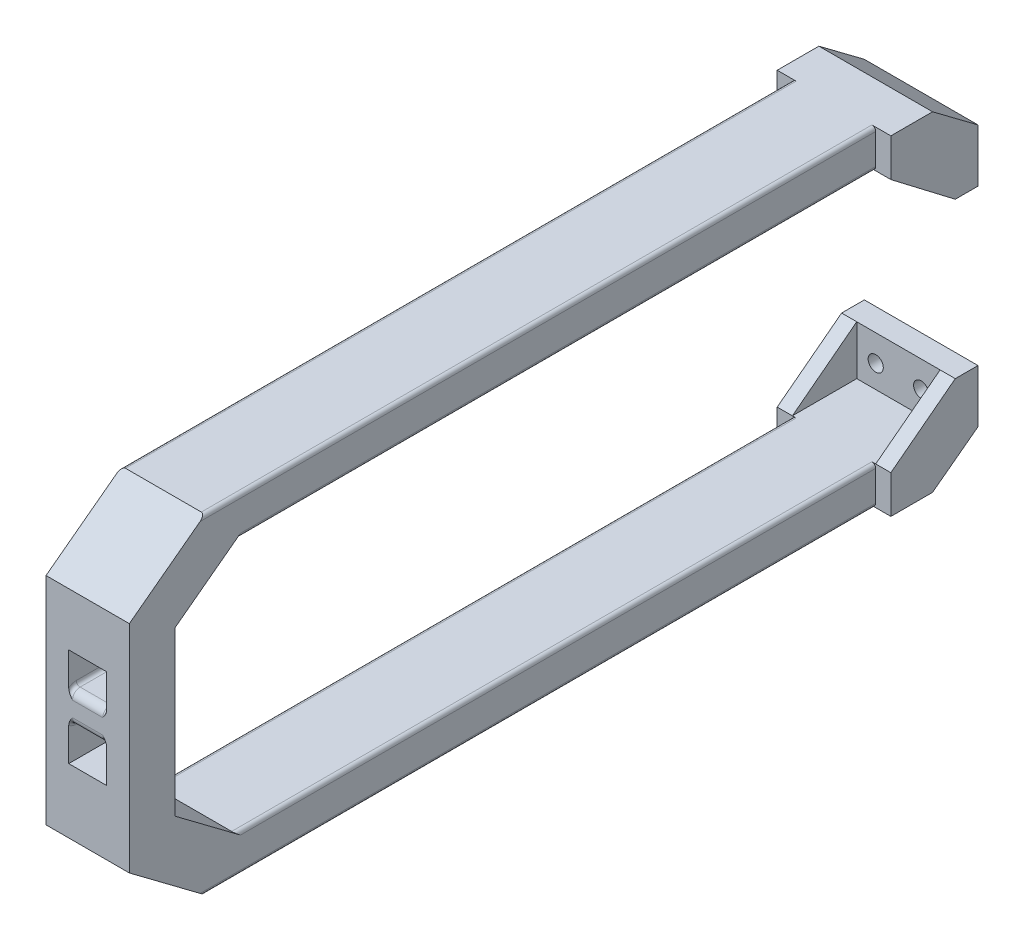
from build123d import *

# Parameters (mm, degrees)
SKETCH1_W                 = 30
SKETCH1_H                 = 87
BOSS_EXTRUDE1_DEPTH       = 220
CUT_EXTRUDE1_DEPTH        = 239.472220604
SKETCH3_W                 = 22
SKETCH3_H                 = 22
CUT_EXTRUDE2_DEPTH        = 13
SKETCH4_W                 = 22
SKETCH4_H                 = 22
CUT_EXTRUDE3_DEPTH        = 13
CUT_EXTRUDE4_REACH        = 240.472
SKETCH5_W                 = 10
SKETCH5_H                 = 9
SKETCH6_W                 = 4
SKETCH6_H                 = 87
CUT_EXTRUDE5_DEPTH        = 197
F_4_0MM_DOWEL_HOLE1_D     = 4
F_4_0MM_DOWEL_HOLE1_DEPTH = 6
FILLET1_R                 = 2
FILLET2_R                 = 1


with BuildPart() as part:
    # Sketch1 → Boss-Extrude1 (new body)
    with BuildSketch(Plane.XY):
        with Locations((15, 43.5)):
            Rectangle(SKETCH1_W, SKETCH1_H)
    extrude(amount=BOSS_EXTRUDE1_DEPTH)

    # Sketch2 → Cut-Extrude1 (cut, through all)
    with BuildSketch(Plane(origin=(30, 0, 0), x_dir=(0, 0, -1), z_dir=(1, 0, 0))):
        Polygon((-192, 77), (-23, 77), (-6, 64), (0, 64), (0, 23), (-6, 23), (-23, 10), (-192, 10), (-208, 22), (-208, 65), align=None)
        Polygon((0, 87), (-12, 87), (0, 78), align=None)
        Polygon((0, 0), (-12, 0), (0, 9), align=None)
        Polygon((-220, 87), (-220, 72), (-200, 87), align=None)
        Polygon((-220, 0), (-220, 15), (-200, 0), align=None)
    extrude(amount=-CUT_EXTRUDE1_DEPTH, mode=Mode.SUBTRACT)

    # Sketch3 → Cut-Extrude2 (cut)
    with BuildSketch(Plane(origin=(0, 64, 0), x_dir=(-1, 0, 0), z_dir=(0, -1, 0))):
        with Locations((-15, -17)):
            Rectangle(SKETCH3_W, SKETCH3_H)
    extrude(amount=-CUT_EXTRUDE2_DEPTH, mode=Mode.SUBTRACT)

    # Sketch4 → Cut-Extrude3 (cut)
    with BuildSketch(Plane(origin=(0, 23, 0), x_dir=(1, 0, 0), z_dir=(0, 1, 0))):
        with Locations((15, -17)):
            Rectangle(SKETCH4_W, SKETCH4_H)
    extrude(amount=-CUT_EXTRUDE3_DEPTH, mode=Mode.SUBTRACT)

    # Sketch5 → Cut-Extrude4 (cut, up to next)
    with BuildSketch(Plane.XY.offset(220), mode=Mode.PRIVATE) as cut_extrude4_sk1:
        with Locations((15, 53.5)):
            Rectangle(SKETCH5_W, SKETCH5_H)
    cut_extrude4_tool1 = extrude(cut_extrude4_sk1.sketch, amount=-CUT_EXTRUDE4_REACH, mode=Mode.PRIVATE) & part.part
    # Sketch5 → Cut-Extrude4 (cut, up to next)
    with BuildSketch(Plane.XY.offset(220), mode=Mode.PRIVATE) as cut_extrude4_sk2:
        with Locations((15, 36.5)):
            Rectangle(SKETCH5_W, SKETCH5_H)
    cut_extrude4_tool2 = extrude(cut_extrude4_sk2.sketch, amount=-CUT_EXTRUDE4_REACH, mode=Mode.PRIVATE) & part.part
    add(cut_extrude4_tool1.solids().sort_by_distance((15, 53.5, 220))[0], mode=Mode.SUBTRACT)
    add(cut_extrude4_tool2.solids().sort_by_distance((15, 36.5, 220))[0], mode=Mode.SUBTRACT)

    # Sketch6 → Cut-Extrude5 (cut)
    with BuildSketch(Plane.XY.offset(220)):
        with Locations((2, 43.5)):
            Rectangle(SKETCH6_W, SKETCH6_H)
        with Locations((28, 43.5)):
            Rectangle(SKETCH6_W, SKETCH6_H)
    extrude(amount=-CUT_EXTRUDE5_DEPTH, mode=Mode.SUBTRACT)

    # Ø4.0mm Dowel Hole1
    with Locations(Plane.XY.offset(6)):
        with Locations((9, 16), (9, 71), (21, 71), (21, 16)):
            Hole(F_4_0MM_DOWEL_HOLE1_D / 2, depth=F_4_0MM_DOWEL_HOLE1_DEPTH)

    # Fillet1
    fillet1_edges = [part.edges().sort_by_distance(p)[0] for p in [
        (15, 49, 220),
        (15, 49, 208),
        (15, 41, 220),
        (15, 41, 208),
    ]]
    fillet(fillet1_edges, radius=FILLET1_R)

    # Fillet2
    # the kernel refuses this fillet: 1 mm, written as the material it adds along each edge
    with BuildSketch(Plane(origin=(10, 49, 218), x_dir=(1, 0, 0), z_dir=(0, 0, -1)), Plane(origin=(20, 41, 218), x_dir=(-1, 0, 0), z_dir=(0, 0, -1))) as fillet2_piece_1:
        with BuildLine():
            CenterArc((FILLET2_R, -FILLET2_R), FILLET2_R, 90, 90)
            Line((0, -FILLET2_R), (0, 0))
            Line((0, 0), (FILLET2_R, 0))
        make_face()
    extrude(amount=8)
    with BuildSketch(Plane(origin=(20, 49, 218), x_dir=(-1, 0, 0), z_dir=(0, 0, -1)), Plane(origin=(10, 41, 218), x_dir=(1, 0, 0), z_dir=(0, 0, -1))) as fillet2_piece_2:
        with BuildLine():
            CenterArc((FILLET2_R, FILLET2_R), FILLET2_R, 180, 90)
            Line((0, FILLET2_R), (0, 0))
            Line((0, 0), (FILLET2_R, 0))
        make_face()
    extrude(amount=8)
    with BuildSketch(Plane(origin=(10, 47, 210), x_dir=(0, -0.9491428341660849, -0.31484580408697216), z_dir=(0, -0.31484580408697216, 0.9491428341660849))) as fillet2_piece_3_section:
        with BuildLine():
            CenterArc((2 + FILLET2_R, FILLET2_R), FILLET2_R, 180, 90)
            Line((2 + FILLET2_R, 0), (2, 0))
            Line((2, 0), (2, FILLET2_R))
        make_face()
    fillet2_piece_3 = revolve(axis=Axis((10, 47, 210), (1, 0, 0)), revolution_arc=161.648494619, mode=Mode.PRIVATE)
    fillet2_piece_3 = split(fillet2_piece_3, bisect_by=Plane(origin=(10.272150961, 48.462196414, 208), z_dir=(0, 0, 1)), keep=Keep.TOP, mode=Mode.PRIVATE)
    add(fillet2_piece_3)
    with BuildSketch(Plane(origin=(20, 47, 210), x_dir=(0, -0.9491428341660849, -0.31484580408697216), z_dir=(0, -0.31484580408697216, 0.9491428341660849))) as fillet2_piece_4_section:
        with BuildLine():
            CenterArc((2 + FILLET2_R, -FILLET2_R), FILLET2_R, 90, 90)
            Line((2 + FILLET2_R, 0), (2, 0))
            Line((2, 0), (2, -FILLET2_R))
        make_face()
    fillet2_piece_4 = revolve(axis=Axis((20, 47, 210), (1, 0, 0)), revolution_arc=161.648494619, mode=Mode.PRIVATE)
    fillet2_piece_4 = split(fillet2_piece_4, bisect_by=Plane(origin=(19.727849107, 48.462196279, 208), z_dir=(0, 0, 1)), keep=Keep.TOP, mode=Mode.PRIVATE)
    add(fillet2_piece_4)
    with BuildSketch(Plane(origin=(20, 43, 210), x_dir=(0, 0.9491428341660849, -0.31484580408697216), z_dir=(0, 0.31484580408697216, 0.9491428341660849))) as fillet2_piece_5_section:
        with BuildLine():
            CenterArc((2 + FILLET2_R, FILLET2_R), FILLET2_R, 180, 90)
            Line((2 + FILLET2_R, 0), (2, 0))
            Line((2, 0), (2, FILLET2_R))
        make_face()
    fillet2_piece_5 = revolve(axis=Axis((20, 43, 210), (-1, 0, 0)), revolution_arc=161.648494619, mode=Mode.PRIVATE)
    fillet2_piece_5 = split(fillet2_piece_5, bisect_by=Plane(origin=(19.727848664, 41.537804063, 208), z_dir=(0, 0, 1)), keep=Keep.TOP, mode=Mode.PRIVATE)
    add(fillet2_piece_5)
    with BuildSketch(Plane(origin=(10, 43, 210), x_dir=(0, 0.9491428341660849, -0.31484580408697216), z_dir=(0, 0.31484580408697216, 0.9491428341660849))) as fillet2_piece_6_section:
        with BuildLine():
            CenterArc((2 + FILLET2_R, -FILLET2_R), FILLET2_R, 90, 90)
            Line((2 + FILLET2_R, 0), (2, 0))
            Line((2, 0), (2, -FILLET2_R))
        make_face()
    fillet2_piece_6 = revolve(axis=Axis((10, 43, 210), (-1, 0, 0)), revolution_arc=161.648494619, mode=Mode.PRIVATE)
    fillet2_piece_6 = split(fillet2_piece_6, bisect_by=Plane(origin=(10.272151404, 41.537803928, 208), z_dir=(0, 0, 1)), keep=Keep.TOP, mode=Mode.PRIVATE)
    add(fillet2_piece_6)
    with BuildSketch(Plane(origin=(20, 47, 218), x_dir=(0, -0.9491428341660849, 0.31484580408697216), z_dir=(0, -0.31484580408697216, -0.9491428341660849))) as fillet2_piece_7_section:
        with BuildLine():
            CenterArc((2 + FILLET2_R, FILLET2_R), FILLET2_R, 180, 90)
            Line((2 + FILLET2_R, 0), (2, 0))
            Line((2, 0), (2, FILLET2_R))
        make_face()
    fillet2_piece_7 = revolve(axis=Axis((20, 47, 218), (-1, 0, 0)), revolution_arc=161.648494619, mode=Mode.PRIVATE)
    fillet2_piece_7 = split(fillet2_piece_7, bisect_by=Plane(origin=(19.727849077, 48.462196209, 220), z_dir=(0, 0, -1)), keep=Keep.TOP, mode=Mode.PRIVATE)
    add(fillet2_piece_7)
    with BuildSketch(Plane(origin=(10, 47, 218), x_dir=(0, -0.9491428341660849, 0.31484580408697216), z_dir=(0, -0.31484580408697216, -0.9491428341660849))) as fillet2_piece_8_section:
        with BuildLine():
            CenterArc((2 + FILLET2_R, -FILLET2_R), FILLET2_R, 90, 90)
            Line((2, -FILLET2_R), (2, 0))
            Line((2, 0), (2 + FILLET2_R, 0))
        make_face()
    fillet2_piece_8 = revolve(axis=Axis((10, 47, 218), (-1, 0, 0)), revolution_arc=161.648494619, mode=Mode.PRIVATE)
    fillet2_piece_8 = split(fillet2_piece_8, bisect_by=Plane(origin=(10.272143952, 48.462199818, 220), z_dir=(0, 0, -1)), keep=Keep.TOP, mode=Mode.PRIVATE)
    add(fillet2_piece_8)
    with BuildSketch(Plane(origin=(10, 43, 218), x_dir=(0, 0.9491428341660849, 0.31484580408697216), z_dir=(0, 0.31484580408697216, -0.9491428341660849))) as fillet2_piece_9_section:
        with BuildLine():
            CenterArc((2 + FILLET2_R, FILLET2_R), FILLET2_R, 180, 90)
            Line((2 + FILLET2_R, 0), (2, 0))
            Line((2, 0), (2, FILLET2_R))
        make_face()
    fillet2_piece_9 = revolve(axis=Axis((10, 43, 218), (1, 0, 0)), revolution_arc=161.648494619, mode=Mode.PRIVATE)
    fillet2_piece_9 = split(fillet2_piece_9, bisect_by=Plane(origin=(10.272150964, 41.537803607, 220), z_dir=(0, 0, -1)), keep=Keep.TOP, mode=Mode.PRIVATE)
    add(fillet2_piece_9)
    with BuildSketch(Plane(origin=(20, 43, 218), x_dir=(0, 0.9491428341660849, 0.31484580408697216), z_dir=(0, 0.31484580408697216, -0.9491428341660849))) as fillet2_piece_10_section:
        with BuildLine():
            CenterArc((2 + FILLET2_R, -FILLET2_R), FILLET2_R, 90, 90)
            Line((2 + FILLET2_R, 0), (2, 0))
            Line((2, 0), (2, -FILLET2_R))
        make_face()
    fillet2_piece_10 = revolve(axis=Axis((20, 43, 218), (1, 0, 0)), revolution_arc=161.648494619, mode=Mode.PRIVATE)
    fillet2_piece_10 = split(fillet2_piece_10, bisect_by=Plane(origin=(19.727849077, 41.537803791, 220), z_dir=(0, 0, -1)), keep=Keep.TOP, mode=Mode.PRIVATE)
    add(fillet2_piece_10)
    # the kernel refuses this fillet: 1 mm, written as the material it takes off along each edge
    with BuildSketch(Plane(origin=(4, 0, 202.5), x_dir=(0, 1, 0), z_dir=(0, 0, -1)), Plane(origin=(26, 87, 202.5), x_dir=(0, -1, 0), z_dir=(0, 0, -1))) as fillet2_2_piece_1:
        with BuildLine():
            CenterArc((FILLET2_R, FILLET2_R), FILLET2_R, 180, 90)
            Line((0, FILLET2_R), (0, 0))
            Line((0, 0), (FILLET2_R, 0))
        make_face()
    extrude(amount=179.5, mode=Mode.SUBTRACT)
    with BuildSketch(Plane(origin=(4, 10, 23), x_dir=(0, -1, 0), z_dir=(0, 0, 1))) as fillet2_2_piece_2_section:
        with BuildLine():
            CenterArc((FILLET2_R, FILLET2_R), FILLET2_R, 180, 90)
            Line((0, FILLET2_R), (0, 0))
            Line((0, 0), (FILLET2_R, 0))
        make_face()
    fillet2_2_piece_2 = extrude(amount=171.5, mode=Mode.PRIVATE)
    fillet2_2_piece_2 = split(fillet2_2_piece_2, bisect_by=Plane(origin=(4.130770438, -71.137574021, 83.816567972), z_dir=(0, 0.8, -0.6)), keep=Keep.TOP, mode=Mode.PRIVATE)
    add(fillet2_2_piece_2, mode=Mode.SUBTRACT)
    with BuildSketch(Plane(origin=(4, 77, 194.5), x_dir=(0, 1, 0), z_dir=(0, 0, -1))) as fillet2_2_piece_3_section:
        with BuildLine():
            CenterArc((FILLET2_R, FILLET2_R), FILLET2_R, 180, 90)
            Line((0, FILLET2_R), (0, 0))
            Line((0, 0), (FILLET2_R, 0))
        make_face()
    fillet2_2_piece_3 = extrude(amount=171.5, mode=Mode.PRIVATE)
    fillet2_2_piece_3 = split(fillet2_2_piece_3, bisect_by=Plane(origin=(4.223692297, 117.641585147, 137.811219805), z_dir=(0, -0.8, -0.6)), keep=Keep.TOP, mode=Mode.PRIVATE)
    add(fillet2_2_piece_3, mode=Mode.SUBTRACT)
    with BuildSketch(Plane(origin=(4, 87, 202.5), x_dir=(0, -1, 0), z_dir=(0, 0, -1)), Plane(origin=(26, 0, 202.5), x_dir=(0, 1, 0), z_dir=(0, 0, -1))) as fillet2_2_piece_4:
        with BuildLine():
            CenterArc((FILLET2_R, -FILLET2_R), FILLET2_R, 90, 90)
            Line((0, -FILLET2_R), (0, 0))
            Line((0, 0), (FILLET2_R, 0))
        make_face()
    extrude(amount=179.5, mode=Mode.SUBTRACT)
    with BuildSketch(Plane(origin=(26, 10, 23), x_dir=(0, -1, 0), z_dir=(0, 0, 1))) as fillet2_2_piece_5_section:
        with BuildLine():
            CenterArc((FILLET2_R, -FILLET2_R), FILLET2_R, 90, 90)
            Line((0, -FILLET2_R), (0, 0))
            Line((0, 0), (FILLET2_R, 0))
        make_face()
    fillet2_2_piece_5 = extrude(amount=171.5, mode=Mode.PRIVATE)
    fillet2_2_piece_5 = split(fillet2_2_piece_5, bisect_by=Plane(origin=(25.869229562, -71.137574021, 83.816567972), z_dir=(0, 0.8, -0.6)), keep=Keep.TOP, mode=Mode.PRIVATE)
    add(fillet2_2_piece_5, mode=Mode.SUBTRACT)
    with BuildSketch(Plane(origin=(26, 77, 194.5), x_dir=(0, 1, 0), z_dir=(0, 0, -1))) as fillet2_2_piece_6_section:
        with BuildLine():
            CenterArc((FILLET2_R, -FILLET2_R), FILLET2_R, 90, 90)
            Line((0, -FILLET2_R), (0, 0))
            Line((0, 0), (FILLET2_R, 0))
        make_face()
    fillet2_2_piece_6 = extrude(amount=171.5, mode=Mode.PRIVATE)
    fillet2_2_piece_6 = split(fillet2_2_piece_6, bisect_by=Plane(origin=(25.776307703, 117.641585147, 137.811219805), z_dir=(0, -0.8, -0.6)), keep=Keep.TOP, mode=Mode.PRIVATE)
    add(fillet2_2_piece_6, mode=Mode.SUBTRACT)


solid = part.part
